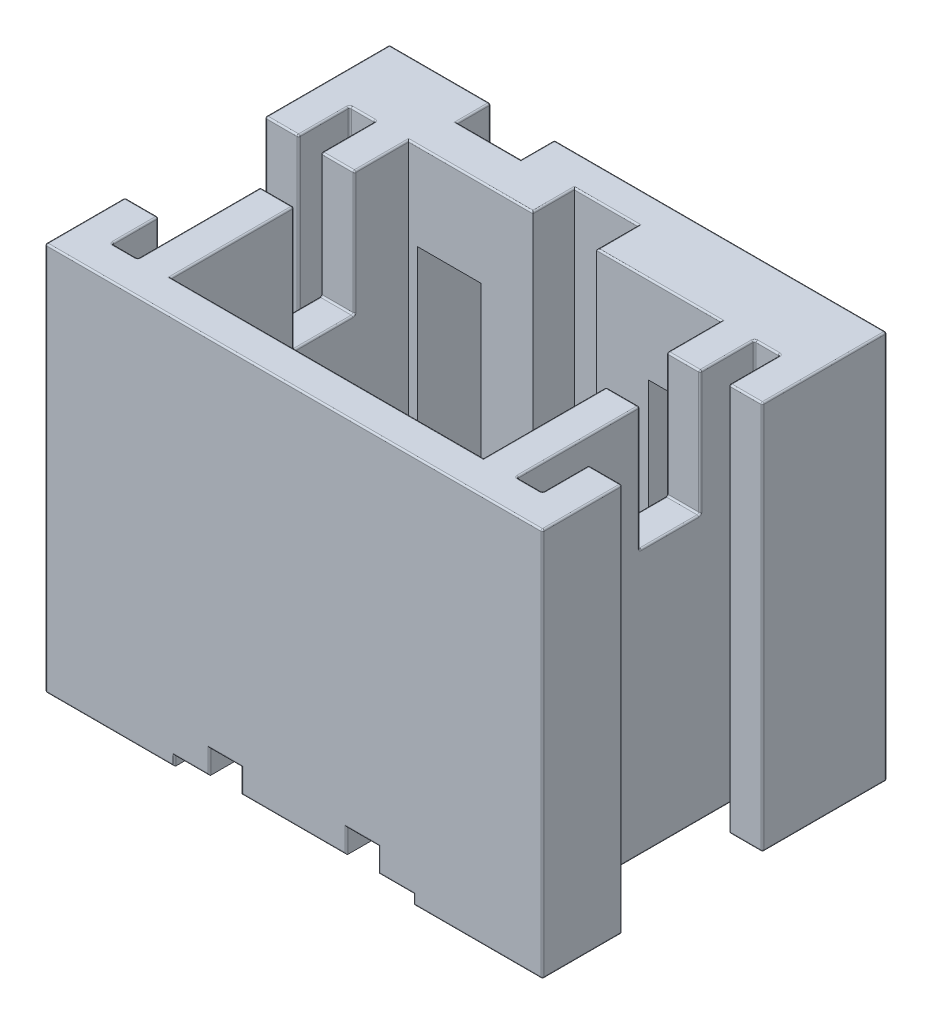
from build123d import *

# Parameters (mm, degrees)
SKETCH1_W               = 7.9248
SKETCH1_H               = 5.4864
BOSS_EXTRUDE1_DEPTH     = 6.1976
CUT_EXTRUDE1_DEPTH      = 8.850860192
CUT_EXTRUDE2_DEPTH      = 4.3434
SKETCH5_W               = 1.016
SKETCH5_H               = 4.8006
CUT_EXTRUDE3_DEPTH      = 1.1684
SKETCH6_W               = 1.016
SKETCH6_H               = 0.5334
CUT_EXTRUDE4_DEPTH      = 0.6096
CUT_EXTRUDE5_DEPTH      = 8.850860192
CUT_EXTRUDE5_DEPTH_BACK = 8.850860192
SKETCH7_W               = 0.9652
SKETCH7_H               = 1.9812
SKETCH8_W               = 0.2032
SKETCH8_H               = 0.127
BOSS_EXTRUDE2_DEPTH     = 2.5654
CUT_EXTRUDE6_DEPTH      = 3.302
BOSS_EXTRUDE3_DEPTH     = 0.508
CHAMFER1_SIZE           = 0.659911358
CHAMFER1_SIZE_2         = 0.381
FILLET1_R               = 0.0254
SKETCH11_W              = 0.3556
SKETCH11_H              = 0.3556
CUT_EXTRUDE7_DEPTH      = 7.159225045


with BuildPart() as part:
    # Sketch1 → Boss-Extrude1 (new body)
    with BuildSketch(Plane(origin=(0, 0, 0), x_dir=(1, 0, 0), z_dir=(0, 1, 0))):
        Rectangle(SKETCH1_W, SKETCH1_H)
    extrude(amount=BOSS_EXTRUDE1_DEPTH)

    # Sketch3 → Cut-Extrude1 (cut, through all)
    with BuildSketch(Plane(origin=(0, 6.1976, 0), x_dir=(1, 0, 0), z_dir=(0, 1, 0))):
        Polygon((-3.9624, 0.762), (-3.429, 0.762), (-3.429, 1.5748), (-3.0226, 1.5748), (-3.0226, -2.2098), (-3.429, -2.2098), (-3.429, -1.4732), (-3.9624, -1.4732), align=None)
        Polygon((3.429, -1.4732), (3.429, -2.2098), (3.0226, -2.2098), (3.0226, 1.5748), (3.429, 1.5748), (3.429, 0.762), (3.9624, 0.762), (3.9624, -1.4732), align=None)
    extrude(amount=-CUT_EXTRUDE1_DEPTH, mode=Mode.SUBTRACT)

    # Sketch4 → Cut-Extrude2 (cut)
    with BuildSketch(Plane(origin=(0, 6.1976, 0), x_dir=(1, 0, 0), z_dir=(0, 1, 0))):
        Polygon((0.508, 1.5748), (2.4892, 1.5748), (2.4892, -2.2098), (-2.4892, -2.2098), (-2.4892, 1.5748), (-0.508, 1.5748), (-0.508, 2.2352), (0.508, 2.2352), align=None)
    extrude(amount=-CUT_EXTRUDE2_DEPTH, mode=Mode.SUBTRACT)

    # Sketch5 → Cut-Extrude3 (cut)
    with BuildSketch(Plane(origin=(0, 0, -2.7432), x_dir=(-1, 0, 0), z_dir=(0, 0, -1))):
        with Locations((-1.8415, 2.4003)):
            Rectangle(SKETCH5_W, SKETCH5_H)
        with Locations((1.8415, 2.4003)):
            Rectangle(SKETCH5_W, SKETCH5_H)
    extrude(amount=-CUT_EXTRUDE3_DEPTH, mode=Mode.SUBTRACT)

    # Sketch6 → Cut-Extrude4 (cut)
    with BuildSketch(Plane(origin=(0, 6.1976, 0), x_dir=(1, 0, 0), z_dir=(0, 1, 0))):
        with Locations((-1.8415, 2.4765)):
            Rectangle(SKETCH6_W, SKETCH6_H)
    extrude(amount=-CUT_EXTRUDE4_DEPTH, mode=Mode.SUBTRACT)

    # Sketch7 → Cut-Extrude5 (cut, two sides: drawn at the far end of the back side and taken through both)
    with BuildSketch(Plane(origin=(0, 0, 0), x_dir=(0, 0, -1), z_dir=(1, 0, 0)).offset(-CUT_EXTRUDE5_DEPTH_BACK)):
        with Locations((0.2286, 5.207)):
            Rectangle(SKETCH7_W, SKETCH7_H)
    extrude(amount=CUT_EXTRUDE5_DEPTH + CUT_EXTRUDE5_DEPTH_BACK, mode=Mode.SUBTRACT)

    # Sketch8 → Boss-Extrude2 (add)
    with BuildSketch(Plane(origin=(0, 1.8542, 0), x_dir=(1, 0, 0), z_dir=(0, 1, 0))):
        with Locations((0, -2.1463)):
            Rectangle(SKETCH8_W, SKETCH8_H)
    extrude(amount=BOSS_EXTRUDE2_DEPTH)

    # Sketch9 → Cut-Extrude6 (cut)
    with BuildSketch(Plane.XY.offset(2.7432)):
        Polygon((-1.905, 0), (1.905, 0), (1.905, 0.1524), (1.3462, 0.1524), (1.3462, 0.5334), (0.8382, 0.5334), (0.8382, 0.1524), (-0.8382, 0.1524), (-0.8382, 0.5334), (-1.3462, 0.5334), (-1.3462, 0.1524), (-1.905, 0.1524), align=None)
    extrude(amount=-CUT_EXTRUDE6_DEPTH, mode=Mode.SUBTRACT)

    # Sketch10 → Boss-Extrude3 (add)
    with BuildSketch(Plane(origin=(0, 1.8542, 0), x_dir=(1, 0, 0), z_dir=(0, 1, 0))):
        Polygon((-1.845733333, -0.3175), (-0.321733333, -0.3175), (-0.321733333, 1.5748), (-0.321733333, 2.2352), (-0.508, 2.2352), (-0.508, 1.5748), (-1.845733333, 1.5748), align=None)
        Polygon((1.845733333, -0.3175), (0.321733333, -0.3175), (0.321733333, 1.5748), (0.321733333, 2.2352), (0.508, 2.2352), (0.508, 1.5748), (1.845733333, 1.5748), align=None)
    extrude(amount=BOSS_EXTRUDE3_DEPTH)

    # Chamfer1
    # the kernel refuses this chamfer: 0.659911358, 0.381 mm, written as the material it adds along each edge
    with BuildSketch(Plane(origin=(1.845733333, 1.8542, 0.3175), x_dir=(0, 0.9998132206222079, -0.019326765612700626), z_dir=(-1, 0, 0))) as chamfer1_piece_1_section:
        Polygon((CHAMFER1_SIZE * 0.999813220143, -CHAMFER1_SIZE * 0.0193267656034), (-CHAMFER1_SIZE_2 * 0.0193267656127, -CHAMFER1_SIZE_2 * 0.999813220622), (0, 0), align=None)
    chamfer1_piece_1 = extrude(amount=1.524, mode=Mode.PRIVATE)
    chamfer1_piece_1 = split(chamfer1_piece_1, bisect_by=Plane(origin=(1.083733333, 2.3622, 0.449970631), z_dir=(0, -1, 0)), keep=Keep.TOP, mode=Mode.PRIVATE)
    add(chamfer1_piece_1)
    with BuildSketch(Plane(origin=(3.552980606, 1.8542, 0.3175), x_dir=(0, 0.9998132206222078, -0.01932676561270063), z_dir=(-1, 0, 0))) as chamfer1_piece_2_section:
        Polygon((CHAMFER1_SIZE * 0.999813220143, -CHAMFER1_SIZE * 0.0193267656034), (-CHAMFER1_SIZE_2 * 0.0193267656127, -CHAMFER1_SIZE_2 * 0.999813220622), (0, 0), align=None)
    chamfer1_piece_2 = extrude(amount=4.938494546, mode=Mode.PRIVATE)
    chamfer1_piece_2 = split(chamfer1_piece_2, bisect_by=Plane(origin=(-0.853623636, 2.3622, 0.449970631), z_dir=(0, -1, 0)), keep=Keep.TOP, mode=Mode.PRIVATE)
    chamfer1_piece_2 = split(chamfer1_piece_2, bisect_by=Plane(origin=(-0.321733333, 2.055219631, 0.449970631), z_dir=(-1, 0, 0)), keep=Keep.TOP, mode=Mode.PRIVATE)
    add(chamfer1_piece_2)
    with BuildSketch(Plane(origin=(-1.845733333, 1.8542, 0.3175), x_dir=(0, 0.9998132206222079, -0.019326765612700626), z_dir=(1, 0, 0))) as chamfer1_piece_3_section:
        Polygon((CHAMFER1_SIZE * 0.999813220143, CHAMFER1_SIZE * 0.0193267656034), (-CHAMFER1_SIZE_2 * 0.0193267656127, CHAMFER1_SIZE_2 * 0.999813220622), (0, 0), align=None)
    chamfer1_piece_3 = extrude(amount=1.524, mode=Mode.PRIVATE)
    chamfer1_piece_3 = split(chamfer1_piece_3, bisect_by=Plane(origin=(-1.083733333, 2.3622, 0.449970631), z_dir=(0, -1, 0)), keep=Keep.TOP, mode=Mode.PRIVATE)
    add(chamfer1_piece_3)
    with BuildSketch(Plane(origin=(-3.552980606, 1.8542, 0.3175), x_dir=(0, 0.9998132206222078, -0.01932676561270063), z_dir=(1, 0, 0))) as chamfer1_piece_4_section:
        Polygon((CHAMFER1_SIZE * 0.999813220143, CHAMFER1_SIZE * 0.0193267656034), (-CHAMFER1_SIZE_2 * 0.0193267656127, CHAMFER1_SIZE_2 * 0.999813220622), (0, 0), align=None)
    chamfer1_piece_4 = extrude(amount=4.938494546, mode=Mode.PRIVATE)
    chamfer1_piece_4 = split(chamfer1_piece_4, bisect_by=Plane(origin=(0.853623636, 2.3622, 0.449970631), z_dir=(0, -1, 0)), keep=Keep.TOP, mode=Mode.PRIVATE)
    chamfer1_piece_4 = split(chamfer1_piece_4, bisect_by=Plane(origin=(0.321733333, 2.055219631, 0.449970631), z_dir=(1, 0, 0)), keep=Keep.TOP, mode=Mode.PRIVATE)
    add(chamfer1_piece_4)

    # Fillet1
    fillet1_edges = [part.edges().sort_by_distance(p)[0] for p in [
        (-3.9624, 6.1976, -1.7526),
        (1.8415, 4.8006, -2.7432),
        (-3.15595, 0, -2.7432),
        (-1.3335, 2.4003, -2.7432),
        (-2.3495, 2.4003, -2.7432),
        (-1.8415, 4.8006, -2.7432),
        (-3.15595, 6.1976, -2.7432),
        (0, 6.1976, 2.7432),
        (-2.3495, 5.8928, -2.7432),
        (-1.3335, 5.8928, -2.7432),
        (-2.3495, 6.1976, -2.4765),
        (-1.8415, 6.1976, -2.2098),
        (-1.3335, 6.1976, -2.4765),
        (-1.8415, 5.588, -2.7432),
        (-3.9624, 0, 2.1082),
        (2.4892, 6.1976, -1.143),
        (2.4892, 4.2164, -0.2286),
        (2.4892, 5.207, -0.7112),
        (2.4892, 5.207, 0.254),
        (-2.4892, 6.1976, 1.2319),
        (3.0226, 6.1976, 1.2319),
        (-3.0226, 6.1976, -1.143),
        (-3.0226, 5.207, 0.254),
        (-2.7559, 4.2164, 0.254),
        (-2.4892, 5.207, 0.254),
        (2.7559, 4.2164, 0.254),
        (3.0226, 5.207, 0.254),
        (-2.7559, 6.1976, 0.254),
        (2.7559, 6.1976, 0.254),
        (-3.0226, 5.207, -0.7112),
        (-2.7559, 6.1976, -0.7112),
        (-2.4892, 5.207, -0.7112),
        (2.7559, 6.1976, -0.7112),
        (3.0226, 5.207, -0.7112),
        (-3.0226, 4.2164, -0.2286),
        (-2.7559, 4.2164, -0.7112),
        (-2.4892, 4.2164, -0.2286),
        (2.7559, 4.2164, -0.7112),
        (3.0226, 4.2164, -0.2286),
        (-3.9624, 6.1976, 2.1082),
        (2.9337, 0, 2.7432),
        (-1.905, 0.0762, 2.7432),
        (1.905, 0.0762, 2.7432),
        (1.6256, 0.1524, 2.7432),
        (1.3462, 0.3429, 2.7432),
        (1.0922, 0.5334, 2.7432),
        (0.8382, 0.3429, 2.7432),
        (0, 0.1524, 2.7432),
        (-0.8382, 0.3429, 2.7432),
        (-1.0922, 0.5334, 2.7432),
        (-1.3462, 0.3429, 2.7432),
        (-1.6256, 0.1524, 2.7432),
        (-3.9624, 3.0988, 1.4732),
        (-3.6957, 0, -0.762),
        (-3.9624, 3.0988, -0.762),
        (-3.429, 0, -1.1684),
        (-3.429, 3.0988, -0.762),
        (-3.2258, 0, -1.5748),
        (-3.429, 3.0988, -1.5748),
        (-3.0226, 0, 0.3175),
        (-3.0226, 3.0988, -1.5748),
        (-3.2258, 0, 2.2098),
        (-3.0226, 3.0988, 2.2098),
        (-3.429, 0, 1.8415),
        (-3.429, 3.0988, 2.2098),
        (-3.6957, 0, 1.4732),
        (-3.429, 3.0988, 1.4732),
        (-3.6957, 6.1976, 1.4732),
        (-3.429, 6.1976, 1.8415),
        (-3.2258, 6.1976, 2.2098),
        (-3.0226, 6.1976, 1.2319),
        (-3.2258, 6.1976, -1.5748),
        (-3.429, 6.1976, -1.1684),
        (-3.6957, 6.1976, -0.762),
        (3.9624, 0, -1.7526),
        (3.9624, 6.1976, 2.1082),
        (3.9624, 6.1976, -1.7526),
        (-2.9337, 0, 2.7432),
        (3.6957, 0, -0.762),
        (3.429, 3.0988, -0.762),
        (3.9624, 3.0988, -0.762),
        (3.6957, 0, 1.4732),
        (3.9624, 3.0988, 1.4732),
        (3.429, 0, 1.8415),
        (3.429, 3.0988, 1.4732),
        (3.2258, 0, 2.2098),
        (3.429, 3.0988, 2.2098),
        (3.0226, 0, 0.3175),
        (3.0226, 3.0988, 2.2098),
        (3.2258, 0, -1.5748),
        (-3.9624, 0, -1.7526),
        (3.0226, 3.0988, -1.5748),
        (3.429, 0, -1.1684),
        (3.429, 3.0988, -1.5748),
        (3.6957, 6.1976, -0.762),
        (3.429, 6.1976, -1.1684),
        (3.2258, 6.1976, -1.5748),
        (3.0226, 6.1976, -1.143),
        (3.2258, 6.1976, 2.2098),
        (3.429, 6.1976, 1.8415),
        (3.6957, 6.1976, 1.4732),
        (3.15595, 0, -2.7432),
        (3.9624, 0, 2.1082),
        (1.31445, 6.1976, -2.7432),
        (3.9624, 3.0988, 2.7432),
        (-3.9624, 3.0988, 2.7432),
        (-3.9624, 3.0988, -2.7432),
        (-2.4892, 6.1976, -1.143),
        (0, 6.1976, 2.2098),
        (3.9624, 3.0988, -2.7432),
        (2.4892, 6.1976, 1.2319),
        (1.4986, 6.1976, -1.5748),
        (0.508, 6.1976, -1.905),
        (0, 6.1976, -2.2352),
        (-0.508, 6.1976, -1.905),
        (-1.4986, 6.1976, -1.5748),
        (0, 0, -2.7432),
        (2.3495, 2.4003, -2.7432),
        (1.3335, 2.4003, -2.7432),
    ]]
    fillet(fillet1_edges, radius=FILLET1_R)

    # Sketch11 → Cut-Extrude7 (cut, through all)
    with BuildSketch(Plane(origin=(0, 2.3622, 0), x_dir=(1, 0, 0), z_dir=(0, 1, 0))):
        with Locations((-1.0922, 0.3429)):
            Rectangle(SKETCH11_W, SKETCH11_H)
        with Locations((1.0922, 0.3429)):
            Rectangle(SKETCH11_W, SKETCH11_H)
    extrude(amount=-CUT_EXTRUDE7_DEPTH, mode=Mode.SUBTRACT)


solid = part.part
